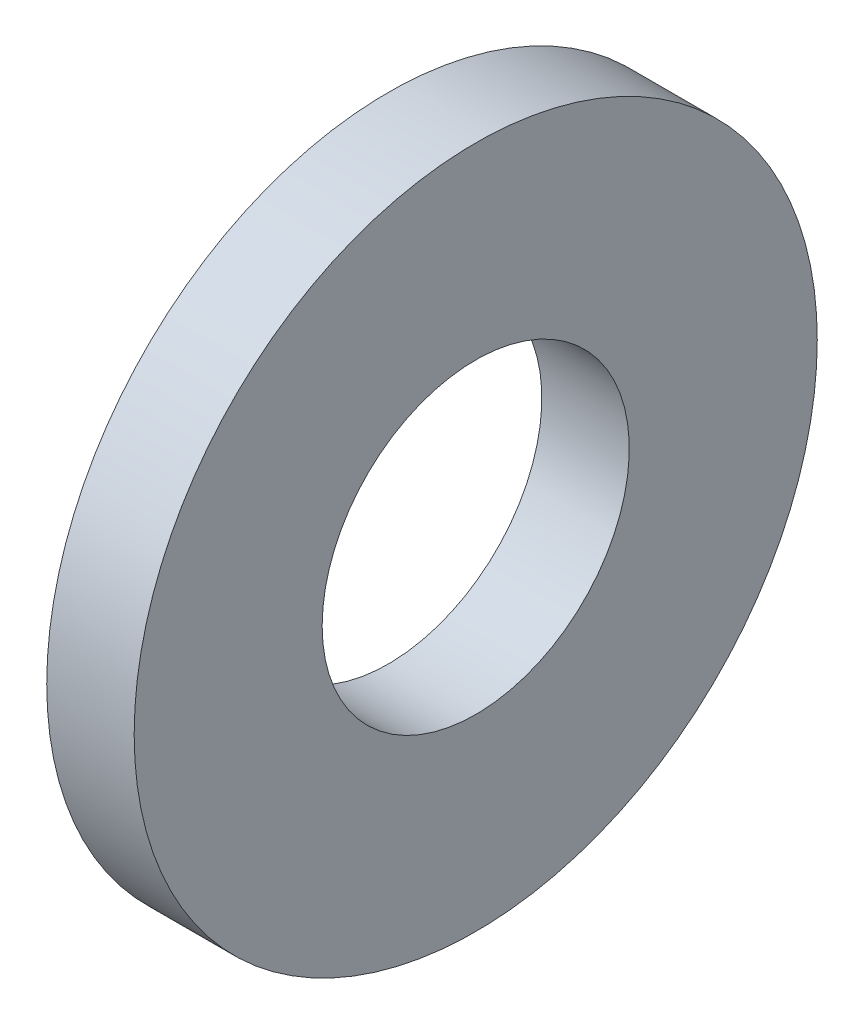
from build123d import *

# Parameters (mm, degrees)
SKETCH1_R           = 7.9375
SKETCH1_R_2         = 3.5687
BOSS_EXTRUDE1_DEPTH = 2.032


with BuildPart() as part:
    # Sketch1 → Boss-Extrude1 (new body)
    with BuildSketch(Plane(origin=(0, 0, 0), x_dir=(0, 0, -1), z_dir=(1, 0, 0))):
        Circle(SKETCH1_R)
        Circle(SKETCH1_R_2, mode=Mode.SUBTRACT)
    extrude(amount=BOSS_EXTRUDE1_DEPTH)


solid = part.part
